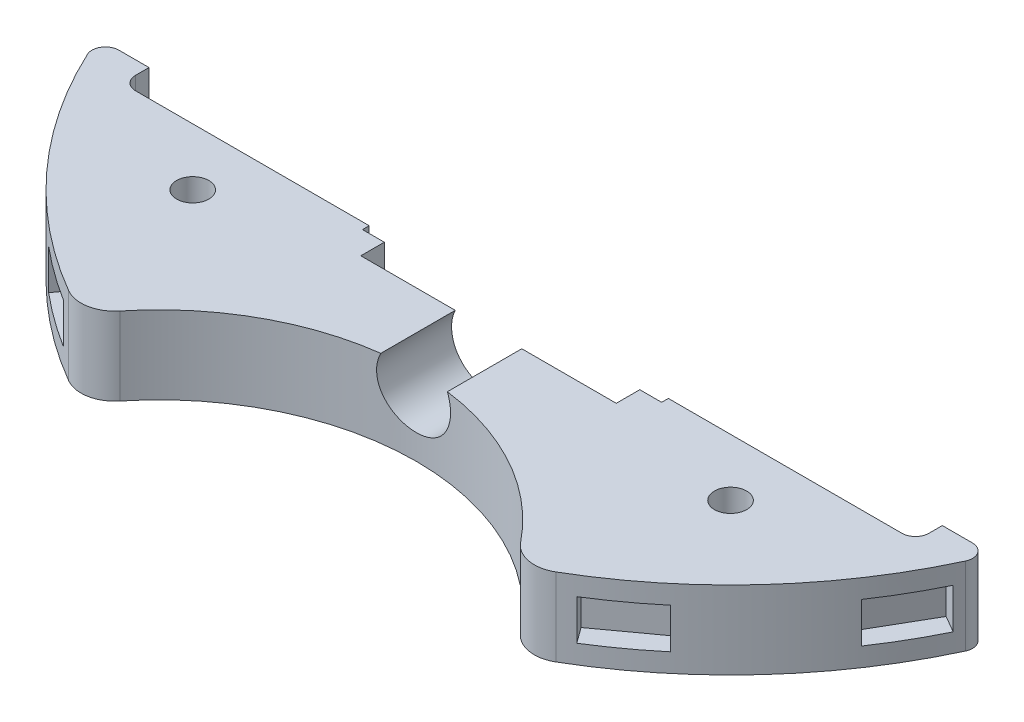
from build123d import *

# Parameters (mm, degrees)
BOSS_EXTRUDE1_DEPTH  = 5.8
SOLENOID_PLACEMENT_W = 38
SOLENOID_PLACEMENT_H = 64
CUT_EXTRUDE1_DEPTH   = 103.481998419
SKETCH6_R            = 2.4
CUT_EXTRUDE6_DEPTH   = 103.481998419
CUT_EXTRUDE3_DEPTH   = 103.481998419
FILLET1_R            = 2
CUT_EXTRUDE7_DEPTH   = 3
SKETCH11_R           = 5.5
CUT_EXTRUDE8_DEPTH   = 72.028583754
SKETCH12_W           = 44.5
SKETCH12_H           = 65
CUT_EXTRUDE9_DEPTH   = 92.53668667


with BuildPart() as part:
    # Sketch1 → Boss-Extrude1 (new, symmetric)
    with BuildSketch(Plane(origin=(0, 0, 0), x_dir=(1, 0, 0), z_dir=(0, 1, 0))):
        with BuildLine():
            ThreePointArc((36.224522061, -62.223661106), (0, 72), (-36.224522061, -62.223661106))
            ThreePointArc((-36.224522061, -62.223661106), (-32.797800029, -62.818856853), (-29.811944095, -61.035223988))
            ThreePointArc((-29.811944095, -61.035223988), (0, -46.75), (29.811944095, -61.035223988))
            ThreePointArc((29.811944095, -61.035223988), (32.797800029, -62.818856853), (36.224522061, -62.223661106))
        make_face()
    extrude(amount=BOSS_EXTRUDE1_DEPTH, both=True)

    # solenoid placement → Cut-Extrude1 (cut, through all)
    with BuildSketch(Plane(origin=(0, 5.8, 0), x_dir=(1, 0, 0), z_dir=(0, 1, 0))):
        with Locations((0, -4)):
            Rectangle(SOLENOID_PLACEMENT_W, SOLENOID_PLACEMENT_H)
    extrude(amount=-CUT_EXTRUDE1_DEPTH, mode=Mode.SUBTRACT)

    # Sketch6 → Cut-Extrude6 (cut, through all)
    with BuildSketch(Plane(origin=(0, 5.8, 0), x_dir=(1, 0, 0), z_dir=(0, 1, 0))):
        with Locations((40, -40)):
            Circle(SKETCH6_R)
        with Locations((-40, -40)):
            Circle(SKETCH6_R)
    extrude(amount=-CUT_EXTRUDE6_DEPTH, mode=Mode.SUBTRACT)

    # Sketch3 → Cut-Extrude3 (cut, through all)
    with BuildSketch(Plane(origin=(0, 5.8, 0), x_dir=(1, 0, 0), z_dir=(0, 1, 0))):
        Polygon((-72, -27.5), (-59, -27.5), (-59, -31.5), (59, -31.5), (59, -27.5), (72, -27.5), (72, 31.5), (72, 72), (-72, 72), (-72, 31.5), align=None)
    extrude(amount=-CUT_EXTRUDE3_DEPTH, mode=Mode.SUBTRACT)

    # Fillet1
    fillet1_edges = [part.edges().sort_by_distance(p)[0] for p in [
        (66.541340534, 0, 27.5),
        (59, 0, 31.5),
        (-66.541340534, 0, 27.5),
        (-59, 0, 31.5),
    ]]
    fillet(fillet1_edges, radius=FILLET1_R)

    # Sketch9 → Cut-Extrude7 (cut, symmetric)
    with BuildSketch(Plane(origin=(0, 0, 0), x_dir=(1, 0, 0), z_dir=(0, 1, 0))):
        with BuildLine():
            Line((-64.703295733, -31.582962517), (-62.191822062, -30.132962517))
            Line((-62.191822062, -30.132962517), (-57.191822062, -38.793216555))
            Line((-57.191822062, -38.793216555), (-59.703295733, -40.243216555))
            ThreePointArc((-59.703295733, -40.243216555), (-62.353829072, -36), (-64.703295733, -31.582962517))
        make_face()
        with BuildLine():
            Line((-46.263453759, -55.169673248), (-44.558876527, -52.823523965))
            Line((-44.558876527, -52.823523965), (-36.468706583, -58.701376488))
            Line((-36.468706583, -58.701376488), (-38.173283815, -61.047525771))
            ThreePointArc((-38.173283815, -61.047525771), (-42.320538165, -58.249223595), (-46.263453759, -55.169673248))
        make_face()
        with BuildLine():
            Line((38.173283815, -61.047525771), (36.468706583, -58.701376488))
            Line((36.468706583, -58.701376488), (44.558876527, -52.823523965))
            Line((44.558876527, -52.823523965), (46.263453759, -55.169673248))
            ThreePointArc((46.263453759, -55.169673248), (42.320538165, -58.249223595), (38.173283815, -61.047525771))
        make_face()
        with BuildLine():
            Line((59.703295733, -40.243216555), (57.191822062, -38.793216555))
            Line((57.191822062, -38.793216555), (62.191822062, -30.132962517))
            Line((62.191822062, -30.132962517), (64.703295733, -31.582962517))
            ThreePointArc((64.703295733, -31.582962517), (62.353829072, -36), (59.703295733, -40.243216555))
        make_face()
    extrude(amount=CUT_EXTRUDE7_DEPTH, both=True, mode=Mode.SUBTRACT)

    # Sketch11 → Cut-Extrude8 (cut, through all)
    with BuildSketch(Plane(origin=(0, 0, 36), x_dir=(-1, 0, 0), z_dir=(0, 0, -1))):
        with Locations((0, 3.4)):
            Circle(SKETCH11_R)
    extrude(amount=-CUT_EXTRUDE8_DEPTH, mode=Mode.SUBTRACT)

    # Sketch12 → Cut-Extrude9 (cut, through all)
    with BuildSketch(Plane(origin=(0, 5.8, 0), x_dir=(1, 0, 0), z_dir=(0, 1, 0))):
        Rectangle(SKETCH12_W, SKETCH12_H)
    extrude(amount=-CUT_EXTRUDE9_DEPTH, mode=Mode.SUBTRACT)


solid = part.part
